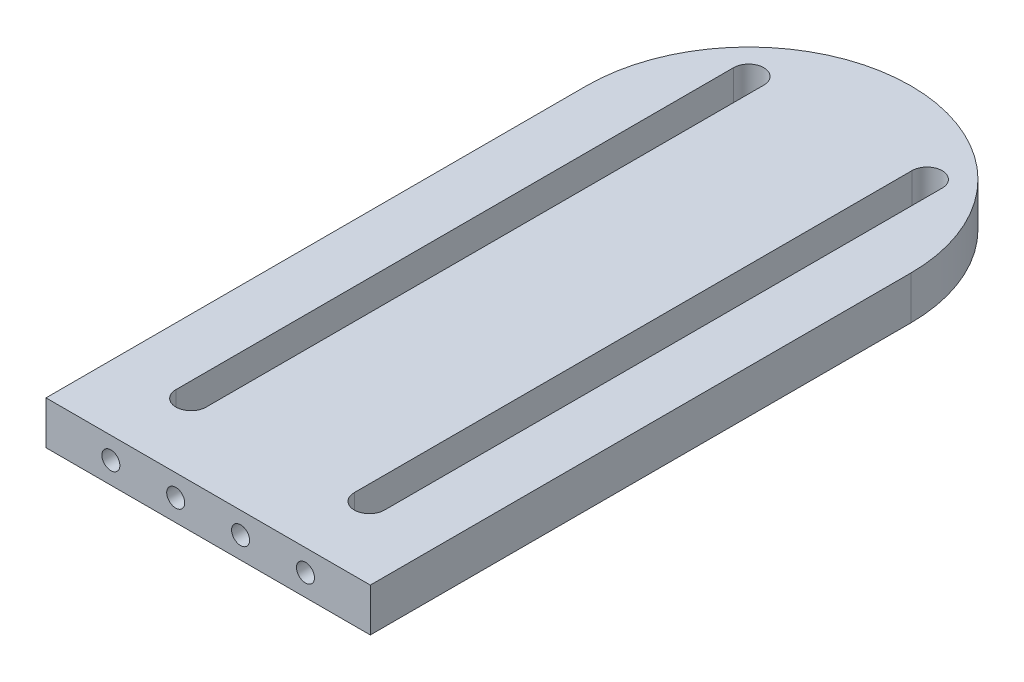
from build123d import *

# Parameters (mm, degrees)
EXTRUDE_1_DEPTH     = 6
CUT_EXTRUDE_1_DEPTH = 79.531840676
M3X0_51_D           = 2.5
M3X0_51_DEPTH       = 8.5
M3X0_51_TIP         = 0.751075774


with BuildPart() as part:
    # Эскиз1 → Бобышка-Вытянуть1 (new body)
    with BuildSketch(Plane(origin=(0, 0, 0), x_dir=(1, 0, 0), z_dir=(0, 1, 0))):
        with BuildLine():
            Line((-22.5, 0), (-22.5, -75))
            Line((-22.5, -75), (22.5, -75))
            Line((22.5, -75), (22.5, 0))
            ThreePointArc((22.5, 0), (0, 22.5), (-22.5, 0))
        make_face()
    extrude(amount=EXTRUDE_1_DEPTH)

    # Эскиз2 → Вырез-Вытянуть1 (cut, through all)
    with BuildSketch(Plane(origin=(0, 6, 0), x_dir=(1, 0, 0), z_dir=(0, 1, 0))):
        with BuildLine():
            Line((-10.274368671, 12.374368671), (-10.274368671, -65))
            ThreePointArc((-10.274368671, -65), (-12.374368671, -67.1), (-14.474368671, -65))
            Line((-14.474368671, -65), (-14.474368671, 12.374368671))
            ThreePointArc((-14.474368671, 12.374368671), (-12.374368671, 14.474368671), (-10.274368671, 12.374368671))
        make_face()
        with BuildLine():
            Line((10.274368671, 12.374368671), (10.274368671, -65))
            ThreePointArc((10.274368671, -65), (12.374368671, -67.1), (14.474368671, -65))
            Line((14.474368671, -65), (14.474368671, 12.374368671))
            ThreePointArc((14.474368671, 12.374368671), (12.374368671, 14.474368671), (10.274368671, 12.374368671))
        make_face()
    extrude(amount=-CUT_EXTRUDE_1_DEPTH, mode=Mode.SUBTRACT)

    # Отверстие обработанное метчиком M3x0.51
    with Locations(Plane.XY.offset(75)):
        with Locations((-13.5, 3), (-4.5, 3), (4.5, 3), (13.5, 3)):
            Hole(M3X0_51_D / 2, depth=M3X0_51_DEPTH)
            with Locations((0, 0, -(M3X0_51_DEPTH + M3X0_51_TIP / 2))):  # 118° drill point
                Cone(0, M3X0_51_D / 2, M3X0_51_TIP, mode=Mode.SUBTRACT)


solid = part.part
